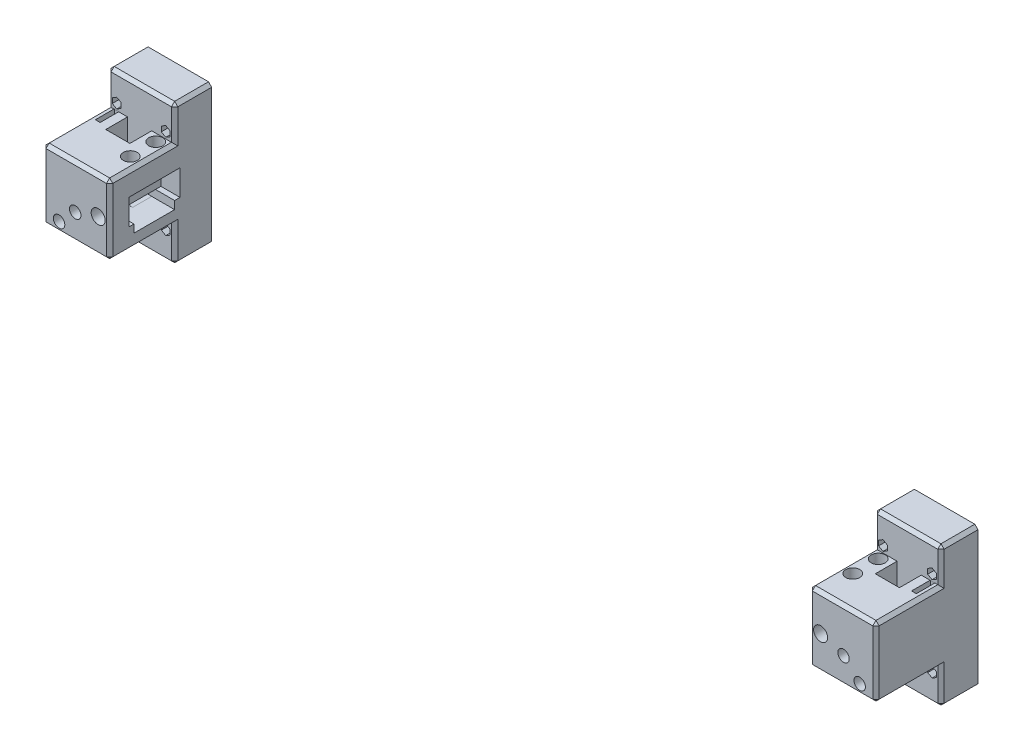
from build123d import *

# Parameters (mm, degrees)
SKETCH1_W                = 34.3
SKETCH1_H                = 70.3
SKETCH1_W_2              = 110
SKETCH1_H_2              = 9.85
BOSS_EXTRUDE1_DEPTH      = 15.048264774
BOSS_EXTRUDE3_DEPTH      = 10
BOSS_EXTRUDE4_DEPTH      = 27.518264774
CUT_EXTRUDE1_DEPTH       = 97.82308708
CUT_EXTRUDE1_DEPTH_BACK  = 97.82308708
SKETCH4_R                = 2
CUT_EXTRUDE3_DEPTH       = 77.2053469
CUT_EXTRUDE3_DEPTH_BACK  = 77.2053469
SKETCH8_W                = 129.903835659
SKETCH8_H                = 83.627886417
SKETCH9_W                = 44.357950904
SKETCH9_H                = 70.607950904
SKETCH9_W_2              = 20
SKETCH9_H_2              = 40
BOSS_EXTRUDE5_DEPTH      = 15.048264774
SKETCH10_W               = 20.2
SKETCH10_H               = 40.2
SKETCH10_W_2             = 20
SKETCH10_H_2             = 40
CUT_EXTRUDE6_DEPTH       = 81.359319258
SKETCH11_R               = 3
CUT_EXTRUDE7_DEPTH       = 30
CUT_EXTRUDE8_DEPTH       = 105.313703151
CUT_EXTRUDE8_DEPTH_BACK  = 8
SKETCH12_R               = 5.5
CUT_EXTRUDE10_DEPTH      = 81.359319258
CUT_EXTRUDE10_DEPTH_BACK = 81.359319258
SKETCH14_W               = 7.032197939
SKETCH14_H               = 32
SKETCH19_W               = 44.357950904
SKETCH19_H               = 70.453975452
BOSS_EXTRUDE9_DEPTH      = 3
BOSS_EXTRUDE6_DEPTH      = 19.3
SKETCH16_R               = 3.4
BOSS_EXTRUDE7_DEPTH      = 2.35
SKETCH18_W               = 18.048264774
SKETCH18_H               = 5.321024548
BOSS_EXTRUDE8_DEPTH      = 15
SKETCH20_R               = 3.4
BOSS_EXTRUDE10_DEPTH     = 1.85
BOSS_EXTRUDE11_DEPTH     = 15.85
SKETCH22_R               = 3.4
BOSS_EXTRUDE12_DEPTH     = 1.8
BOSS_EXTRUDE13_OUTLINE_R = 3.4
BOSS_EXTRUDE13_DEPTH     = 34.003975452
SKETCH26_W               = 18.048264774
SKETCH26_H               = 2.15
BOSS_EXTRUDE16_DEPTH     = 5.321024548
SKETCH24_R               = 3.4
BOSS_EXTRUDE14_DEPTH     = 1.8
BOSS_EXTRUDE15_DEPTH     = 18.503975452
CUT_EXTRUDE11_DEPTH      = 83.549671178
CUT_EXTRUDE11_DEPTH_BACK = 83.549671178
SKETCH27_R               = 2.5
CUT_EXTRUDE12_DEPTH      = 81.923545348
CUT_EXTRUDE12_DEPTH_BACK = 81.923545348
SKETCH28_R               = 2.5
CUT_EXTRUDE15_DEPTH      = 102.880674814
CUT_EXTRUDE15_DEPTH_BACK = 102.880674814
SKETCH29_W               = 3.770821646
SKETCH29_H               = 15
SKETCH30_W               = 52.566529548
SKETCH30_H               = 26.651024548
SKETCH30_R               = 2
SKETCH30_H_2             = 28.348975452
BOSS_EXTRUDE17_DEPTH     = 19.3
CHAMFER1_SIZE            = 2.5
CUT_EXTRUDE16_DEPTH      = 84.96040374
CUT_EXTRUDE16_DEPTH_BACK = 10
SKETCH31_R               = 3
CUT_EXTRUDE17_DEPTH      = 33
SKETCH33_R               = 5.5
CUT_EXTRUDE18_DEPTH      = 8
CUT_EXTRUDE19_DEPTH      = 20
CUT_EXTRUDE20_DEPTH      = 33
SKETCH36_R               = 4.5
CUT_EXTRUDE21_DEPTH      = 12
SKETCH37_R               = 4.5
CUT_EXTRUDE22_DEPTH      = 4


# Read off the part's stored shape, not the designer's step: Boss-Extrude13
with BuildPart() as part:
    # Sketch1 → Boss-Extrude1 (new body)
    # profile 1 of 2: a face of its own
    with BuildSketch(Plane.YZ):
        Rectangle(SKETCH1_W, SKETCH1_H)
        with BuildLine():
            Line((-10.15, 6.7), (-10.15, -6.7))
            ThreePointArc((-10.15, -6.7), (-9.871751442, -7.371751442), (-9.2, -7.65))
            Line((-9.2, -7.65), (-8.5, -7.65))
            ThreePointArc((-8.5, -7.65), (-8.181801948, -7.518198052), (-8.05, -7.2))
            Line((-8.05, -7.2), (-8.05, -5.094911614))
            ThreePointArc((-8.05, -5.094911614), (-7.621019548, -4.452896997), (-6.863711672, -4.603534899))
            Line((-6.863711672, -4.603534899), (-4.684745674, -6.782500897))
            ThreePointArc((-4.684745674, -6.782500897), (-4.066943332, -7.707107441), (-3.85, -8.797755224))
            Line((-3.85, -8.797755224), (-3.85, -11.202244776))
            ThreePointArc((-3.85, -11.202244776), (-4.066943332, -12.292892559), (-4.684745674, -13.217499103))
            Line((-4.684745674, -13.217499103), (-6.863711672, -15.396465101))
            ThreePointArc((-6.863711672, -15.396465101), (-7.621019548, -15.547103003), (-8.05, -14.905088386))
            Line((-8.05, -14.905088386), (-8.05, -12.8))
            ThreePointArc((-8.05, -12.8), (-8.181801948, -12.481801948), (-8.5, -12.35))
            Line((-8.5, -12.35), (-9.2, -12.35))
            ThreePointArc((-9.2, -12.35), (-9.871751442, -12.628248558), (-10.15, -13.3))
            Line((-10.15, -13.3), (-10.15, -18))
            ThreePointArc((-10.15, -18), (-9.52027958, -19.52027958), (-8, -20.15))
            Line((-8, -20.15), (-3.3, -20.15))
            ThreePointArc((-3.3, -20.15), (-2.628248558, -19.871751442), (-2.35, -19.2))
            Line((-2.35, -19.2), (-2.35, -18.5))
            ThreePointArc((-2.35, -18.5), (-2.481801948, -18.181801948), (-2.8, -18.05))
            Line((-2.8, -18.05), (-4.905088386, -18.05))
            ThreePointArc((-4.905088386, -18.05), (-5.547103003, -17.621019548), (-5.396465101, -16.863711672))
            Line((-5.396465101, -16.863711672), (-3.217499103, -14.684745674))
            ThreePointArc((-3.217499103, -14.684745674), (-2.292892559, -14.066943332), (-1.202244776, -13.85))
            Line((-1.202244776, -13.85), (1.202244776, -13.85))
            ThreePointArc((1.202244776, -13.85), (2.292892559, -14.066943332), (3.217499103, -14.684745674))
            Line((3.217499103, -14.684745674), (5.396465101, -16.863711672))
            ThreePointArc((5.396465101, -16.863711672), (5.547103003, -17.621019548), (4.905088386, -18.05))
            Line((4.905088386, -18.05), (2.8, -18.05))
            ThreePointArc((2.8, -18.05), (2.481801948, -18.181801948), (2.35, -18.5))
            Line((2.35, -18.5), (2.35, -19.2))
            ThreePointArc((2.35, -19.2), (2.628248558, -19.871751442), (3.3, -20.15))
            Line((3.3, -20.15), (8, -20.15))
            ThreePointArc((8, -20.15), (9.52027958, -19.52027958), (10.15, -18))
            Line((10.15, -18), (10.15, -13.3))
            ThreePointArc((10.15, -13.3), (9.871751442, -12.628248558), (9.2, -12.35))
            Line((9.2, -12.35), (8.5, -12.35))
            ThreePointArc((8.5, -12.35), (8.181801948, -12.481801948), (8.05, -12.8))
            Line((8.05, -12.8), (8.05, -14.905088386))
            ThreePointArc((8.05, -14.905088386), (7.621019548, -15.547103003), (6.863711672, -15.396465101))
            Line((6.863711672, -15.396465101), (4.684745674, -13.217499103))
            ThreePointArc((4.684745674, -13.217499103), (4.066943332, -12.292892559), (3.85, -11.202244776))
            Line((3.85, -11.202244776), (3.85, -8.797755224))
            ThreePointArc((3.85, -8.797755224), (4.066943332, -7.707107441), (4.684745674, -6.782500897))
            Line((4.684745674, -6.782500897), (6.863711672, -4.603534899))
            ThreePointArc((6.863711672, -4.603534899), (7.621019548, -4.452896997), (8.05, -5.094911614))
            Line((8.05, -5.094911614), (8.05, -7.2))
            ThreePointArc((8.05, -7.2), (8.181801948, -7.518198052), (8.5, -7.65))
            Line((8.5, -7.65), (9.2, -7.65))
            ThreePointArc((9.2, -7.65), (9.871751442, -7.371751442), (10.15, -6.7))
            Line((10.15, -6.7), (10.15, 6.7))
            ThreePointArc((10.15, 6.7), (9.871751442, 7.371751442), (9.2, 7.65))
            Line((9.2, 7.65), (8.5, 7.65))
            ThreePointArc((8.5, 7.65), (8.181801948, 7.518198052), (8.05, 7.2))
            Line((8.05, 7.2), (8.05, 5.094911614))
            ThreePointArc((8.05, 5.094911614), (7.621019548, 4.452896997), (6.863711672, 4.603534899))
            Line((6.863711672, 4.603534899), (4.684745674, 6.782500897))
            ThreePointArc((4.684745674, 6.782500897), (4.066943332, 7.707107441), (3.85, 8.797755224))
            Line((3.85, 8.797755224), (3.85, 11.202244776))
            ThreePointArc((3.85, 11.202244776), (4.066943332, 12.292892559), (4.684745674, 13.217499103))
            Line((4.684745674, 13.217499103), (6.863711672, 15.396465101))
            ThreePointArc((6.863711672, 15.396465101), (7.621019548, 15.547103003), (8.05, 14.905088386))
            Line((8.05, 14.905088386), (8.05, 12.8))
            ThreePointArc((8.05, 12.8), (8.181801948, 12.481801948), (8.5, 12.35))
            Line((8.5, 12.35), (9.2, 12.35))
            ThreePointArc((9.2, 12.35), (9.871751442, 12.628248558), (10.15, 13.3))
            Line((10.15, 13.3), (10.15, 18))
            ThreePointArc((10.15, 18), (9.52027958, 19.52027958), (8, 20.15))
            Line((8, 20.15), (3.3, 20.15))
            ThreePointArc((3.3, 20.15), (2.628248558, 19.871751442), (2.35, 19.2))
            Line((2.35, 19.2), (2.35, 18.5))
            ThreePointArc((2.35, 18.5), (2.481801948, 18.181801948), (2.8, 18.05))
            Line((2.8, 18.05), (4.905088386, 18.05))
            ThreePointArc((4.905088386, 18.05), (5.547103003, 17.621019548), (5.396465101, 16.863711672))
            Line((5.396465101, 16.863711672), (3.217499103, 14.684745674))
            ThreePointArc((3.217499103, 14.684745674), (2.292892559, 14.066943332), (1.202244776, 13.85))
            Line((1.202244776, 13.85), (-1.202244776, 13.85))
            ThreePointArc((-1.202244776, 13.85), (-2.292892559, 14.066943332), (-3.217499103, 14.684745674))
            Line((-3.217499103, 14.684745674), (-5.396465101, 16.863711672))
            ThreePointArc((-5.396465101, 16.863711672), (-5.547103003, 17.621019548), (-4.905088386, 18.05))
            Line((-4.905088386, 18.05), (-2.8, 18.05))
            ThreePointArc((-2.8, 18.05), (-2.481801948, 18.181801948), (-2.35, 18.5))
            Line((-2.35, 18.5), (-2.35, 19.2))
            ThreePointArc((-2.35, 19.2), (-2.628248558, 19.871751442), (-3.3, 20.15))
            Line((-3.3, 20.15), (-8, 20.15))
            ThreePointArc((-8, 20.15), (-9.52027958, 19.52027958), (-10.15, 18))
            Line((-10.15, 18), (-10.15, 13.3))
            ThreePointArc((-10.15, 13.3), (-9.871751442, 12.628248558), (-9.2, 12.35))
            Line((-9.2, 12.35), (-8.5, 12.35))
            ThreePointArc((-8.5, 12.35), (-8.181801948, 12.481801948), (-8.05, 12.8))
            Line((-8.05, 12.8), (-8.05, 14.905088386))
            ThreePointArc((-8.05, 14.905088386), (-7.621019548, 15.547103003), (-6.863711672, 15.396465101))
            Line((-6.863711672, 15.396465101), (-4.684745674, 13.217499103))
            ThreePointArc((-4.684745674, 13.217499103), (-4.066943332, 12.292892559), (-3.85, 11.202244776))
            Line((-3.85, 11.202244776), (-3.85, 8.797755224))
            ThreePointArc((-3.85, 8.797755224), (-4.066943332, 7.707107441), (-4.684745674, 6.782500897))
            Line((-4.684745674, 6.782500897), (-6.863711672, 4.603534899))
            ThreePointArc((-6.863711672, 4.603534899), (-7.621019548, 4.452896997), (-8.05, 5.094911614))
            Line((-8.05, 5.094911614), (-8.05, 7.2))
            ThreePointArc((-8.05, 7.2), (-8.181801948, 7.518198052), (-8.5, 7.65))
            Line((-8.5, 7.65), (-9.2, 7.65))
            ThreePointArc((-9.2, 7.65), (-9.871751442, 7.371751442), (-10.15, 6.7))
        make_face(mode=Mode.SUBTRACT)
    # profile 2 of 2: a face of its own
    with BuildSketch(Plane.YZ):
        with Locations((0, -40.075)):
            Rectangle(SKETCH1_W_2, SKETCH1_H_2)
    extrude(amount=-BOSS_EXTRUDE1_DEPTH)

    # Sketch2 → Boss-Extrude3 (add)
    with BuildSketch(Plane.YZ):
        Polygon((17.15, 35.15), (-17.15, 35.15), (-17.15, -35.15), (-55, -35.15), (-55, -45), (55, -45), (55, -35.15), (17.15, -35.15), align=None)
    extrude(amount=BOSS_EXTRUDE3_DEPTH)

    # Sketch3 → Boss-Extrude4 (add)
    with BuildSketch(Plane.YZ.offset(10)):
        Polygon((-17.15, -35.15), (17.15, -35.15), (55, -35.15), (55, -45), (-55, -45), (-55, -35.15), align=None)
    extrude(amount=BOSS_EXTRUDE4_DEPTH)

    # Sketch4 → Cut-Extrude1 (cut, two sides: drawn at the far end of the back side and taken through both)
    with BuildSketch(Plane.XY.offset(-35.15).offset(-CUT_EXTRUDE1_DEPTH_BACK)):
        with Locations((-8.06818722, 33.5)):
            Circle(SKETCH4_R)
        with Locations((-8.06818722, -33.5)):
            Circle(SKETCH4_R)
        with Locations((30.53818722, -33.5)):
            Circle(SKETCH4_R)
        with Locations((30.53818722, 33.5)):
            Circle(SKETCH4_R)
    extrude(amount=CUT_EXTRUDE1_DEPTH + CUT_EXTRUDE1_DEPTH_BACK, mode=Mode.SUBTRACT)

    # Sketch8 → Cut-Extrude3 (cut, two sides: drawn at the far end of the back side and taken through both)
    with BuildSketch(Plane.YZ.offset(10).offset(-CUT_EXTRUDE3_DEPTH_BACK)):
        with Locations((-9.95191783, 6.663943208)):
            Rectangle(SKETCH8_W, SKETCH8_H)
    extrude(amount=CUT_EXTRUDE3_DEPTH + CUT_EXTRUDE3_DEPTH_BACK, mode=Mode.SUBTRACT)

    # Sketch9 → Boss-Extrude5 (add)
    with BuildSketch(Plane(origin=(-15.048264774, 0, 0), x_dir=(0, -1, 0), z_dir=(-1, 0, 0))):
        with Locations((-0.848975452, 0)):
            Rectangle(SKETCH9_W, SKETCH9_H)
        Rectangle(SKETCH9_W_2, SKETCH9_H_2, mode=Mode.SUBTRACT)
    extrude(amount=-BOSS_EXTRUDE5_DEPTH)

    # Sketch10 → Cut-Extrude6 (cut, through all)
    with BuildSketch(Plane.YZ):
        Rectangle(SKETCH10_W, SKETCH10_H)
        Rectangle(SKETCH10_W_2, SKETCH10_H_2, mode=Mode.SUBTRACT)
    extrude(amount=-CUT_EXTRUDE6_DEPTH, mode=Mode.SUBTRACT)

    # Sketch11 → Cut-Extrude7 (cut)
    with BuildSketch(Plane.XY.offset(35.303975452)):
        with Locations((-6.024132387, 0)):
            Circle(SKETCH11_R)
    extrude(amount=-CUT_EXTRUDE7_DEPTH, mode=Mode.SUBTRACT)

    # Sketch12 → Cut-Extrude8 (cut, two sides: drawn at the far end of the back side and taken through both)
    with BuildSketch(Plane.XY.offset(35.303975452).offset(-CUT_EXTRUDE8_DEPTH_BACK)):
        with Locations((-6.024132387, 0)):
            Circle(SKETCH12_R)
    extrude(amount=CUT_EXTRUDE8_DEPTH + CUT_EXTRUDE8_DEPTH_BACK, mode=Mode.SUBTRACT)

    # Sketch14 → Cut-Extrude10 (cut, two sides: drawn at the far end of the back side and taken through both)
    with BuildSketch(Plane.YZ.offset(-CUT_EXTRUDE10_DEPTH_BACK)):
        with Locations((-12.813901031, 0.15)):
            Rectangle(SKETCH14_W, SKETCH14_H)
    extrude(amount=CUT_EXTRUDE10_DEPTH + CUT_EXTRUDE10_DEPTH_BACK, mode=Mode.SUBTRACT)

    # Sketch19 → Boss-Extrude9 (add)
    # profile 1 of 2: a face of its own
    with BuildSketch(Plane.YZ):
        with Locations((0.848975452, 0.076987726)):
            Rectangle(SKETCH19_W, SKETCH19_H)
        Polygon((-16.33, -15.85), (-16.33, 16.15), (-10.1, 16.15), (-10.1, 20.1), (10.1, 20.1), (10.1, -20.1), (-10.1, -20.1), (-10.1, -15.85), align=None, mode=Mode.SUBTRACT)
    # profile 2 of 2: a face of its own
    with BuildSketch(Plane.YZ):
        Polygon((-10.1, 16.15), (-10.1, -15.85), (-10.1, -20.1), (10.1, -20.1), (10.1, 20.1), (-10.1, 20.1), align=None)
    extrude(amount=BOSS_EXTRUDE9_DEPTH)

    # Sketch15 → Boss-Extrude6 (add)
    with BuildSketch(Plane.XY.offset(-35.15)):
        Polygon((37.518264774, 28.348975452), (-15.048264774, 28.348975452), (-15.048264774, 23.027950904), (3, 23.027950904), (3, -21.33), (-15.048264774, -21.33), (-15.048264774, -26.651024548), (37.518264774, -26.651024548), align=None)
    extrude(amount=BOSS_EXTRUDE6_DEPTH)

    # Sketch16 → Boss-Extrude7 (add)
    with BuildSketch(Plane.XY.offset(-15.85)):
        with Locations(Location((12, -6, 0), (0, 0, 180))):
            Circle(SKETCH16_R)
    extrude(amount=BOSS_EXTRUDE7_DEPTH)

    # Sketch18 → Boss-Extrude8 (add)
    with BuildSketch(Plane.XY.offset(-15.85)):
        with BuildLine():
            ThreePointArc((22, -6), (19.196963711, -12.942889409), (12.359257331, -15.993544625))
            Line((12.359257331, -15.993544625), (3, -16.33))
            Line((3, -16.33), (3, -21.33))
            Line((3, -21.33), (-15.048264774, -21.33))
            Line((-15.048264774, -21.33), (-15.048264774, -26.651024548))
            Line((-15.048264774, -26.651024548), (37.518264774, -26.651024548))
            Line((37.518264774, -26.651024548), (37.518264774, 28.348975452))
            Line((37.518264774, 28.348975452), (22, 28.348975452))
            Line((22, 28.348975452), (22, -6))
        make_face()
        with Locations((-6.024132387, 25.688463178)):
            Rectangle(SKETCH18_W, SKETCH18_H)
    extrude(amount=BOSS_EXTRUDE8_DEPTH)

    # Sketch20 → Boss-Extrude10 (add)
    with BuildSketch(Plane.XY.offset(-0.85)):
        with Locations((24.73, -18.73)):
            Circle(SKETCH20_R)
    extrude(amount=BOSS_EXTRUDE10_DEPTH)

    # Sketch21 → Boss-Extrude11 (add)
    with BuildSketch(Plane.XY.offset(-0.85)):
        Polygon((-15.048264774, -26.651024548), (14.73, -26.651024548), (14.73, -16.33), (3, -16.33), (3, -21.33), (-15.048264774, -21.33), align=None)
        with BuildLine():
            Line((34.73, -18.73), (34.73, -26.651024548))
            Line((34.73, -26.651024548), (37.518264774, -26.651024548))
            Line((37.518264774, -26.651024548), (37.518264774, 28.348975452))
            Line((37.518264774, 28.348975452), (22, 28.348975452))
            Line((22, 28.348975452), (22, -6))
            ThreePointArc((22, -6), (21.904579832, -7.378150334), (21.620140332, -8.73))
            Line((21.620140332, -8.73), (24.73, -8.73))
            ThreePointArc((24.73, -8.73), (31.801067812, -11.658932188), (34.73, -18.73))
        make_face()
    extrude(amount=BOSS_EXTRUDE11_DEPTH)

    # Boss-Extrude13 outline → Boss-Extrude13 (add)
    with BuildSketch(Plane.XY.offset(1.3)):
        with BuildLine():
            Line((22, -6), (22, 28.348975452))
            Line((22, 28.348975452), (-15.048264774, 28.348975452))
            Line((-15.048264774, 28.348975452), (-15.048264774, 23.027950904))
            Line((-15.048264774, 23.027950904), (3, 23.027950904))
            Line((3, 23.027950904), (3, -10.1))
            Line((3, -10.1), (21.566632564, -8.91196521))
            ThreePointArc((21.566632564, -8.91196521), (21.891064797, -7.472018064), (22, -6))
        make_face()
        with Locations((12, -6)):
            Circle(BOSS_EXTRUDE13_OUTLINE_R, mode=Mode.SUBTRACT)
    extrude(amount=BOSS_EXTRUDE13_DEPTH)

    # Sketch26 → Boss-Extrude16 (add)
    with BuildSketch(Plane(origin=(0, 23.027950904, 0), x_dir=(-1, 0, 0), z_dir=(0, 1, 0))):
        with Locations((6.024132387, 0.225)):
            Rectangle(SKETCH26_W, SKETCH26_H)
    extrude(amount=BOSS_EXTRUDE16_DEPTH)

    # Sketch24 → Boss-Extrude14 (add)
    with BuildSketch(Plane.XY.offset(15)):
        with Locations((24.73, -18.73)):
            Circle(SKETCH24_R)
        Polygon((14.73, -16.33), (3, -16.33), (3, -21.33), (-15.048264774, -21.33), (-15.048264774, -26.651024548), (14.73, -26.651024548), align=None)
        with BuildLine():
            Line((34.73, -18.73), (34.73, -26.651024548))
            Line((34.73, -26.651024548), (37.518264774, -26.651024548))
            Line((37.518264774, -26.651024548), (37.518264774, 28.348975452))
            Line((37.518264774, 28.348975452), (22, 28.348975452))
            Line((22, 28.348975452), (22, -6))
            ThreePointArc((22, -6), (21.904579832, -7.378150334), (21.620140332, -8.73))
            Line((21.620140332, -8.73), (24.73, -8.73))
            ThreePointArc((24.73, -8.73), (31.801067812, -11.658932188), (34.73, -18.73))
        make_face()
    extrude(amount=BOSS_EXTRUDE14_DEPTH)


with BuildPart() as body_2:
    # Sketch22 → Boss-Extrude12 (new body)
    with BuildSketch(Plane(origin=(0, 0, -0.5), x_dir=(0, -1, 0), z_dir=(0, 0, 1))):
        with Locations(Location((6, 12, 0), (0, 0, 90))):
            Circle(SKETCH22_R)
    extrude(amount=BOSS_EXTRUDE12_DEPTH)


with BuildPart() as boss_extrude14_piece_1:
    # of the separate pieces the step leaves, piece 1, a body of its own (boss_extrude14_pieces)
    add(part.part.solids().sort_by_distance((-15.048264774, -55, -45))[0])



with BuildPart() as boss_extrude14_piece_2:
    # of the separate pieces the step leaves, piece 2, a body of its own (boss_extrude14_pieces)
    add(part.part.solids().sort_by_distance((28.13, -18.73, 15))[0])


with BuildPart() as boss_extrude14_piece_1_1:
    add(boss_extrude14_piece_1.part)

    add(boss_extrude14_piece_2.part)  # Boss-Extrude15 merges Boss-Extrude14 piece 2
    # Sketch25 → Boss-Extrude15 (add)
    with BuildSketch(Plane.XY.offset(16.8)):
        Polygon((-15.048264774, -26.651024548), (14.73, -26.651024548), (14.73, -16.33), (3, -16.33), (3, -21.33), (-15.048264774, -21.33), align=None)
        with BuildLine():
            Line((37.518264774, 28.348975452), (22, 28.348975452))
            Line((22, 28.348975452), (22, -6))
            ThreePointArc((22, -6), (21.904579832, -7.378150334), (21.620140332, -8.73))
            Line((21.620140332, -8.73), (24.73, -8.73))
            ThreePointArc((24.73, -8.73), (31.801067812, -11.658932188), (34.73, -18.73))
            Line((34.73, -18.73), (34.73, -26.651024548))
            Line((34.73, -26.651024548), (37.518264774, -26.651024548))
            Line((37.518264774, -26.651024548), (37.518264774, 28.348975452))
        make_face()
        with BuildLine():
            Line((24.73, -8.73), (21.620140332, -8.73))
            ThreePointArc((21.620140332, -8.73), (18.171455627, -13.868490036), (12.359257331, -15.993544625))
            Line((12.359257331, -15.993544625), (3, -16.33))
            Line((3, -16.33), (14.73, -16.33))
            Line((14.73, -16.33), (14.73, -26.651024548))
            Line((14.73, -26.651024548), (34.73, -26.651024548))
            Line((34.73, -26.651024548), (34.73, -18.73))
            ThreePointArc((34.73, -18.73), (31.801067812, -11.658932188), (24.73, -8.73))
        make_face()
        with BuildLine():
            Line((3, -16.33), (12.359257331, -15.993544625))
            ThreePointArc((12.359257331, -15.993544625), (19.196963711, -12.942889409), (22, -6))
            Line((22, -6), (22, 28.348975452))
            Line((22, 28.348975452), (3, 28.348975452))
            Line((3, 28.348975452), (3, -10.1))
            Line((3, -10.1), (0, -10.1))
            Line((0, -10.1), (-15.048264774, -10.1))
            Line((-15.048264774, -10.1), (-15.048264774, -16.33))
            Line((-15.048264774, -16.33), (3, -16.33))
        make_face()
    extrude(amount=BOSS_EXTRUDE15_DEPTH)


with BuildPart() as cut_extrude11_tool:
    # Sketch27 → Cut-Extrude11 (new, two sides: drawn at the far end of the back side and taken through both)
    with BuildSketch(Plane.XY.offset(-13.5).offset(-CUT_EXTRUDE11_DEPTH_BACK)):
        with Locations((12, -6)):
            Circle(SKETCH27_R)
    extrude(amount=CUT_EXTRUDE11_DEPTH + CUT_EXTRUDE11_DEPTH_BACK)


with BuildPart() as body_2_1:
    add(body_2.part)

    # Cut-Extrude11: cut by cut_extrude11_tool
    add(cut_extrude11_tool.part, mode=Mode.SUBTRACT)


with BuildPart() as boss_extrude14_piece_1_2:
    add(boss_extrude14_piece_1_1.part)

    # Cut-Extrude11: cut by cut_extrude11_tool
    add(cut_extrude11_tool.part, mode=Mode.SUBTRACT)

    # Sketch28 → Cut-Extrude12 (cut, two sides: drawn at the far end of the back side and taken through both)
    with BuildSketch(Plane.XY.offset(1).offset(-CUT_EXTRUDE12_DEPTH_BACK)):
        with Locations((24.73, -18.73)):
            Circle(SKETCH28_R)
    extrude(amount=CUT_EXTRUDE12_DEPTH + CUT_EXTRUDE12_DEPTH_BACK, mode=Mode.SUBTRACT)

    # Sketch29 → Cut-Extrude15 (cut, two sides: drawn at the far end of the back side and taken through both)
    with BuildSketch(Plane(origin=(0, 28.348975452, 0), x_dir=(-1, 0, 0), z_dir=(0, 1, 0)).offset(-CUT_EXTRUDE15_DEPTH_BACK)):
        with Locations((-30.844589177, -8.75)):
            Rectangle(SKETCH29_W, SKETCH29_H)
    extrude(amount=CUT_EXTRUDE15_DEPTH + CUT_EXTRUDE15_DEPTH_BACK, mode=Mode.SUBTRACT)

    # Sketch30 → Boss-Extrude17 (add)
    # profile 1 of 2: a face of its own
    with BuildSketch(Plane.XY.offset(-35.15)):
        with Locations((11.235, 41.674487726)):
            Rectangle(SKETCH30_W, SKETCH30_H)
        with Locations((30.53818722, 33.5)):
            Circle(SKETCH30_R, mode=Mode.SUBTRACT)
        with Locations((-8.06818722, 33.5)):
            Circle(SKETCH30_R, mode=Mode.SUBTRACT)
    # profile 2 of 2: a face of its own
    with BuildSketch(Plane.XY.offset(-35.15)):
        with Locations((11.235, -40.825512274)):
            Rectangle(SKETCH30_W, SKETCH30_H_2)
        with Locations((-8.06818722, -33.5)):
            Circle(SKETCH30_R, mode=Mode.SUBTRACT)
        with Locations((30.53818722, -33.5)):
            Circle(SKETCH30_R, mode=Mode.SUBTRACT)
    extrude(amount=BOSS_EXTRUDE17_DEPTH)

    # Chamfer1
    chamfer1_edges = [boss_extrude14_piece_1_2.edges().sort_by_distance(p)[0] for p in [
        (11.235, 55, -15.85),
        (-15.048264774, 41.674487726, -15.85),
        (37.518264774, 41.674487726, -15.85),
        (37.518264774, -40.825512274, -15.85),
        (-15.048264774, -40.825512274, -15.85),
        (11.235, -55, -15.85),
        (11.235, -26.651024548, 35.303975452),
        (-15.048264774, -26.651024548, 9.726987726),
        (-15.048264774, 6.463975452, 35.303975452),
        (11.235, 28.348975452, 35.303975452),
        (37.518264774, 28.348975452, 9.726987726),
        (37.518264774, 0.848975452, 35.303975452),
        (37.518264774, -26.651024548, 9.726987726),
        (-15.048264774, 28.348975452, 18.301987726),
        (-15.048264774, -55, -25.5),
        (37.518264774, -55, -25.5),
        (-15.048264774, 55, -25.5),
        (37.518264774, 55, -25.5),
    ]]
    chamfer(chamfer1_edges, length=CHAMFER1_SIZE)

    # Sketch32 → Cut-Extrude16 (cut, two sides: drawn at the far end of the back side and taken through both)
    with BuildSketch(Plane.XY.offset(-15.85).offset(-CUT_EXTRUDE16_DEPTH_BACK)):
        Polygon((-4.604085605, 35.5), (-8.06818722, 37.5), (-11.532288835, 35.5), (-11.532288835, 31.5), (-8.06818722, 29.5), (-4.604085605, 31.5), align=None)
        Polygon((30.53818722, 29.5), (34.002288835, 31.5), (34.002288835, 35.5), (30.53818722, 37.5), (27.074085604, 35.5), (27.074085604, 31.5), align=None)
        Polygon((-8.06818722, -37.5), (-4.604085605, -35.5), (-4.604085605, -31.5), (-8.06818722, -29.5), (-11.532288835, -31.5), (-11.532288835, -35.5), align=None)
        Polygon((30.53818722, -37.5), (34.002288835, -35.5), (34.002288835, -31.5), (30.53818722, -29.5), (27.074085604, -31.5), (27.074085604, -35.5), align=None)
    extrude(amount=CUT_EXTRUDE16_DEPTH + CUT_EXTRUDE16_DEPTH_BACK, mode=Mode.SUBTRACT)

    # Sketch31 → Cut-Extrude17 (cut)
    with BuildSketch(Plane(origin=(0, 3.7, 0), x_dir=(-1, 0, 0), z_dir=(0, 1, 0))):
        with Locations(Location((6.024132387, -10, 0), (0, 0, 270))):
            Circle(SKETCH31_R)
        with Locations(Location((6.024132387, 10, 0), (0, 0, 270))):
            Circle(SKETCH31_R)
    extrude(amount=CUT_EXTRUDE17_DEPTH, mode=Mode.SUBTRACT)

    # Sketch33 → Cut-Extrude18 (cut)
    with BuildSketch(Plane(origin=(0, 28.348975452, 0), x_dir=(-1, 0, 0), z_dir=(0, 1, 0))):
        with Locations(Location((6.024132387, 10, 0), (0, 0, 90))):
            Circle(SKETCH33_R)
        with Locations(Location((6.024132387, -10, 0), (0, 0, 90))):
            Circle(SKETCH33_R)
    extrude(amount=-CUT_EXTRUDE18_DEPTH, mode=Mode.SUBTRACT)

    # Sketch34 → Cut-Extrude19 (cut)
    with BuildSketch(Plane(origin=(0, 0, -45), x_dir=(1, 0, 0), z_dir=(0, 0, -1))):
        Polygon((12, 1.25), (16.113620668, 3.625), (16.113620668, 8.375), (12, 10.75), (7.886379332, 8.375), (7.886379332, 3.625), align=None)
    extrude(amount=-CUT_EXTRUDE19_DEPTH, mode=Mode.SUBTRACT)

    # Sketch35 → Cut-Extrude20 (cut)
    with BuildSketch(Plane(origin=(0, 0, -45), x_dir=(1, 0, 0), z_dir=(0, 0, -1))):
        Polygon((24.73, 13.98), (28.843620668, 16.355), (28.843620668, 21.105), (24.73, 23.48), (20.616379332, 21.105), (20.616379332, 16.355), align=None)
    extrude(amount=-CUT_EXTRUDE20_DEPTH, mode=Mode.SUBTRACT)

    # Sketch36 → Cut-Extrude21 (cut)
    with BuildSketch(Plane.XY.offset(35.303975452)):
        with Locations((12, -6)):
            Circle(SKETCH36_R)
        with Locations((24.73, -18.73)):
            Circle(SKETCH36_R)
    extrude(amount=-CUT_EXTRUDE21_DEPTH, mode=Mode.SUBTRACT)

    # Sketch37 → Cut-Extrude22 (cut)
    with BuildSketch(Plane.XY.offset(23.303975452)):
        with Locations((12, -6)):
            Circle(SKETCH37_R)
    extrude(amount=-CUT_EXTRUDE22_DEPTH, mode=Mode.SUBTRACT)


with BuildPart() as body_3:
    # Mirror2: mirrored copy
    add(boss_extrude14_piece_1_2.part.mirror(Plane(origin=(-290.266735226, 0, 0), x_dir=(0, 0, 1), z_dir=(1, 0, 0))))


solid = Compound([body_2_1.part, boss_extrude14_piece_1_2.part, body_3.part])
